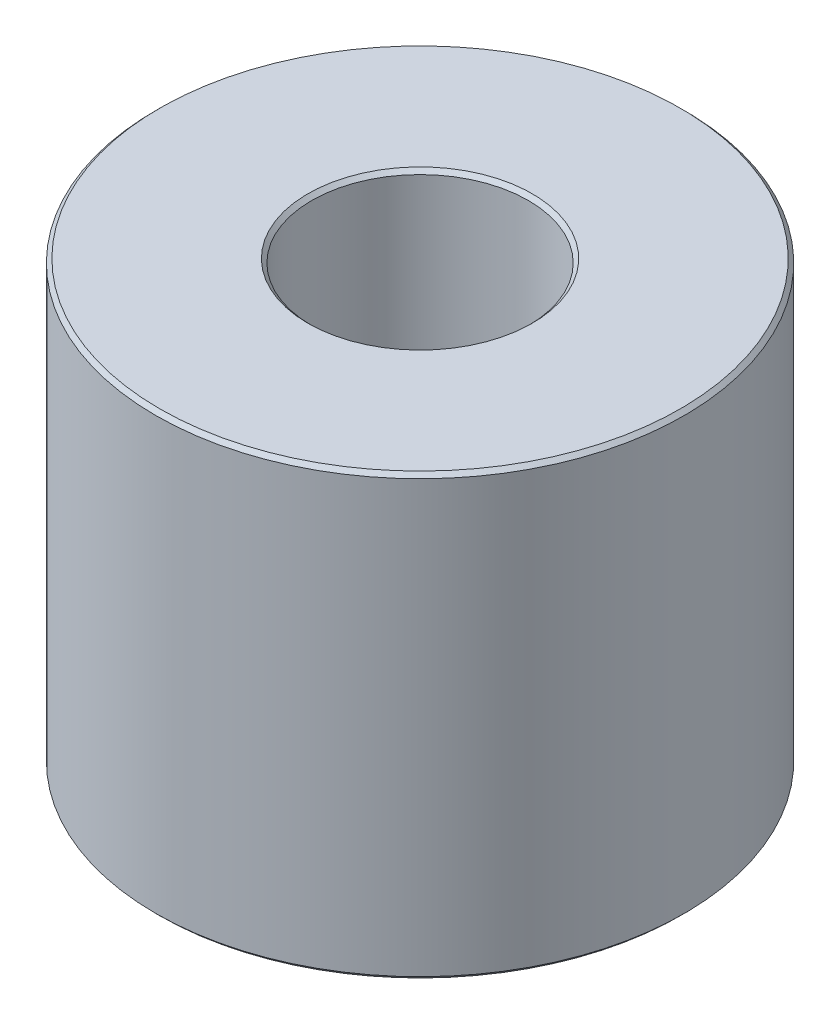
from build123d import *

# Parameters (mm, degrees)
SKETCH1_R           = 17.5
BOSS_EXTRUDE1_DEPTH = 29.074314075
SKETCH2_R           = 7.173604934
CUT_EXTRUDE1_DEPTH  = 39.181353289
CHAMFER1_SIZE       = 0.257517711


with BuildPart() as part:
    # Sketch1 → Boss-Extrude1 (new body)
    with BuildSketch(Plane(origin=(0, 0, 0), x_dir=(1, 0, 0), z_dir=(0, 1, 0))):
        Circle(SKETCH1_R)
    extrude(amount=BOSS_EXTRUDE1_DEPTH)

    # Sketch2 → Cut-Extrude1 (cut, through all)
    with BuildSketch(Plane(origin=(0, 0, 0), x_dir=(1, 0, 0), z_dir=(0, 1, 0))):
        Circle(SKETCH2_R)
    extrude(amount=CUT_EXTRUDE1_DEPTH, mode=Mode.SUBTRACT)

    # Chamfer1
    chamfer1_edges = [part.edges().sort_by_distance(p)[0] for p in [
        (-7.173604934, 29.074314075, 0),
        (-7.173604934, 0, 0),
        (-17.5, 0, 0),
        (-17.5, 29.074314075, 0),
    ]]
    chamfer(chamfer1_edges, length=CHAMFER1_SIZE)


solid = part.part
